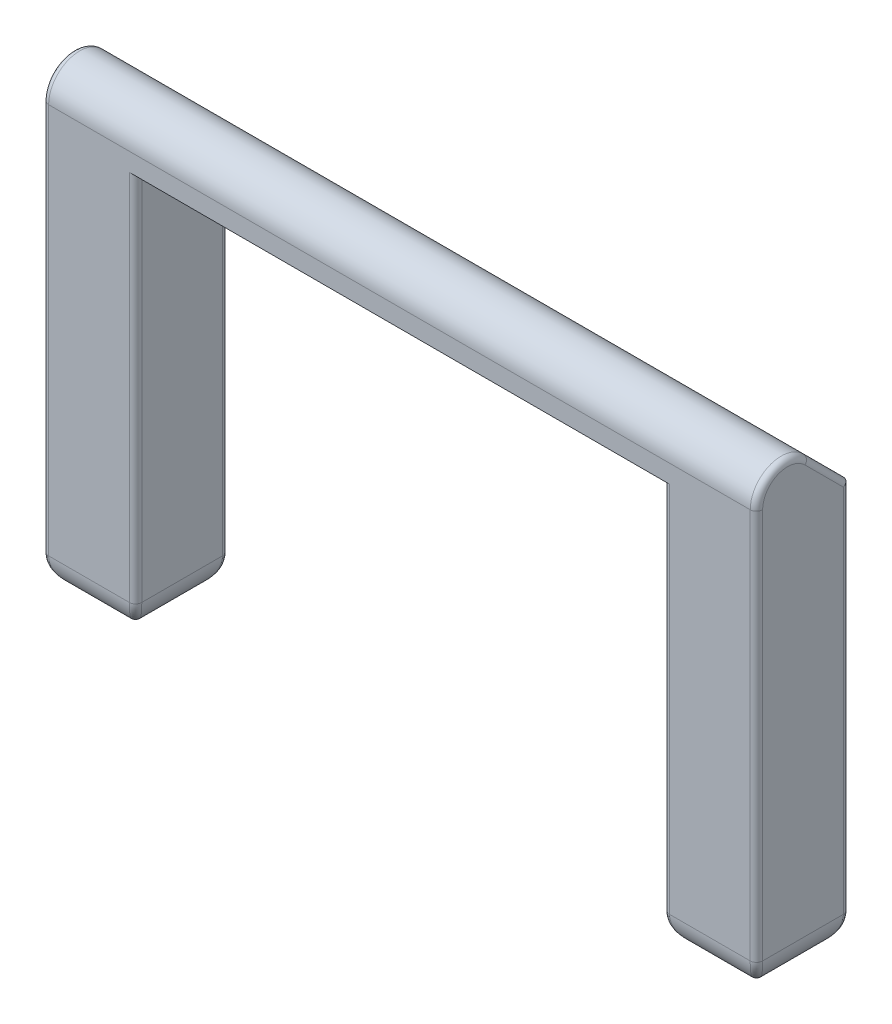
from build123d import *

# Parameters (mm, degrees)
SKETCH_1_W        = 3
SKETCH_1_H        = 3
EXTRUDE_1_DEPTH   = 13
EXTRUDE_1_2_DEPTH = 13
EXTRUDE_2_REACH   = 28.462
FILLET_1_R        = 1
FILLET_2_R        = 0.2


with BuildPart() as part:
    # 草图1 → 凸台-拉伸1 (new body)
    with BuildSketch(Plane(origin=(0, 0, 0), x_dir=(1, 0, 0), z_dir=(0, 1, 0))):
        with Locations((-10, 0)):
            Rectangle(SKETCH_1_W, SKETCH_1_H)
    extrude(amount=EXTRUDE_1_DEPTH)


with BuildPart() as body_2:
    # 草图1 → Extrude 1 2 (new body)
    with BuildSketch(Plane(origin=(0, 0, 0), x_dir=(1, 0, 0), z_dir=(0, 1, 0))):
        with Locations((10, 0)):
            Rectangle(SKETCH_1_W, SKETCH_1_H)
    extrude(amount=EXTRUDE_1_2_DEPTH)

    # 凸台-拉伸2: up to this face of the body (flat: up to its plane)
    extrude_2_end = Plane(body_2.part.faces().sort_by_distance((11.5, 6.5, 0))[0])
    # 草图3 → 凸台-拉伸2 (add, up to the picked face)
    with BuildSketch(Plane.ZY.offset(11.5), mode=Mode.PRIVATE) as extrude_2_sk1:
        with BuildLine():
            Line((1.5, 13), (-0.987867966, 10.512132034))
            ThreePointArc((-0.987867966, 10.512132034), (-1.31480503, 10.447100209), (-1.5, 10.724264069))
            Line((-1.5, 10.724264069), (-1.5, 13))
            Line((-1.5, 13), (-0.207106781, 14.292893219))
            ThreePointArc((-0.207106781, 14.292893219), (0.882683432, 14.50966597), (1.5, 13.585786438))
            Line((1.5, 13.585786438), (1.5, 13))
        make_face()
    extrude_2_tool1 = split(extrude(extrude_2_sk1.sketch, amount=-EXTRUDE_2_REACH, mode=Mode.PRIVATE), bisect_by=extrude_2_end, keep=Keep.BOTH, mode=Mode.PRIVATE)

    add(part.part)  # 凸台-拉伸2 merges part
    add(extrude_2_tool1.solids().sort_by(Axis((-11.5, 12.727618, -0.150654), (1, 0, 0)))[0])

    # 圆角1
    fillet_1_edges = [body_2.edges().sort_by_distance(p)[0] for p in [
        (10, 0, -1.5),
        (11.5, 0, 0),
        (8.5, 0, 0),
        (10, 0, 1.5),
        (-10, 0, 1.5),
        (-11.5, 0, 0),
        (-10, 0, -1.5),
        (-8.5, 0, 0),
    ]]
    fillet(fillet_1_edges, radius=FILLET_1_R)

    # 圆角2
    fillet_2_edges = [body_2.edges().sort_by_distance(p)[0] for p in [
        (-8.5, 5.862132034, -1.5),
        (-11.5, 13.646446609, -0.853553391),
        (-11.5, 14.50966597, 0.882683432),
        (11.5, 7.292893219, 1.5),
        (11.5, 13.646446609, -0.853553391),
        (11.5, 14.50966597, 0.882683432),
        (8.5, 5.862132034, -1.5),
        (8.5, 7, 1.5),
        (11.5, 7, -1.5),
        (-8.853951093, 0.236703983, 1.146048907),
        (-11.146048907, 0.236703983, 1.146048907),
        (-8.5, 7, 1.5),
        (-8.853951093, 0.236703983, -1.146048907),
        (-11.146048907, 0.236703983, -1.146048907),
        (-11.5, 7.292893219, 1.5),
        (-11.5, 7, -1.5),
        (11.146048907, 0.236703983, 1.146048907),
        (8.853951093, 0.236703983, 1.146048907),
        (11.146048907, 0.236703983, -1.146048907),
        (8.853951093, 0.236703983, -1.146048907),
    ]]
    fillet(fillet_2_edges, radius=FILLET_2_R)


solid = body_2.part
